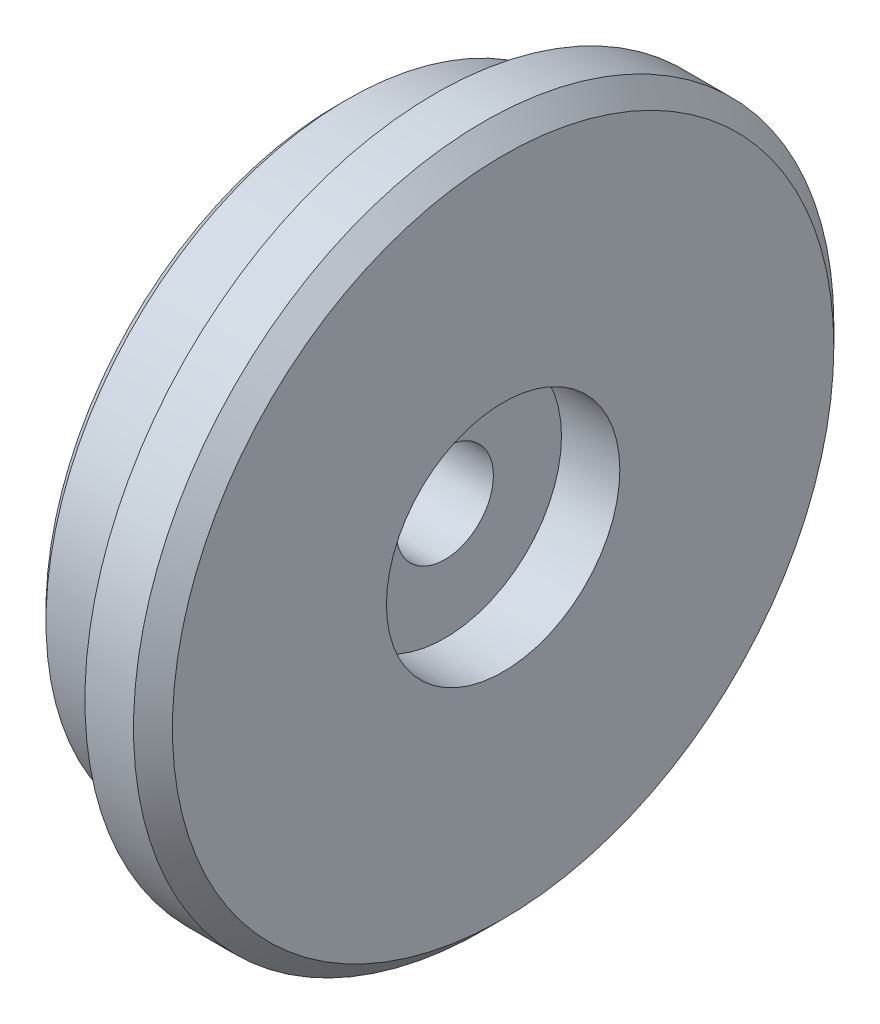
from build123d import *

# Parameters (mm, degrees)
CHAMFER1_SIZE = 1


with BuildPart() as part:
    # Esquisse1 → Révolution1789 (revolve)
    with BuildSketch(Plane.XY):
        Polygon((0, 18), (-3.5, 18), (-3.5, 15), (-4.5, 15), (-4.5, 15.5), (-8, 15.5), (-8.5, 15), (-8.5, 12), (-5.75, 12), (-5, 11.25), (-5, 5.75), (-5.75, 5), (-8.5, 5), (-8.5, 2.5), (-3, 2.5), (-3, 6), (0, 6), align=None)
    revolve(axis=Axis((0, 0, 0), (-1, 0, 0)))

    # Chamfer1
    chamfer1_edges = [part.edges().sort_by_distance(p)[0] for p in [
        (0, -18, 0),
    ]]
    chamfer(chamfer1_edges, length=CHAMFER1_SIZE)


solid = part.part
